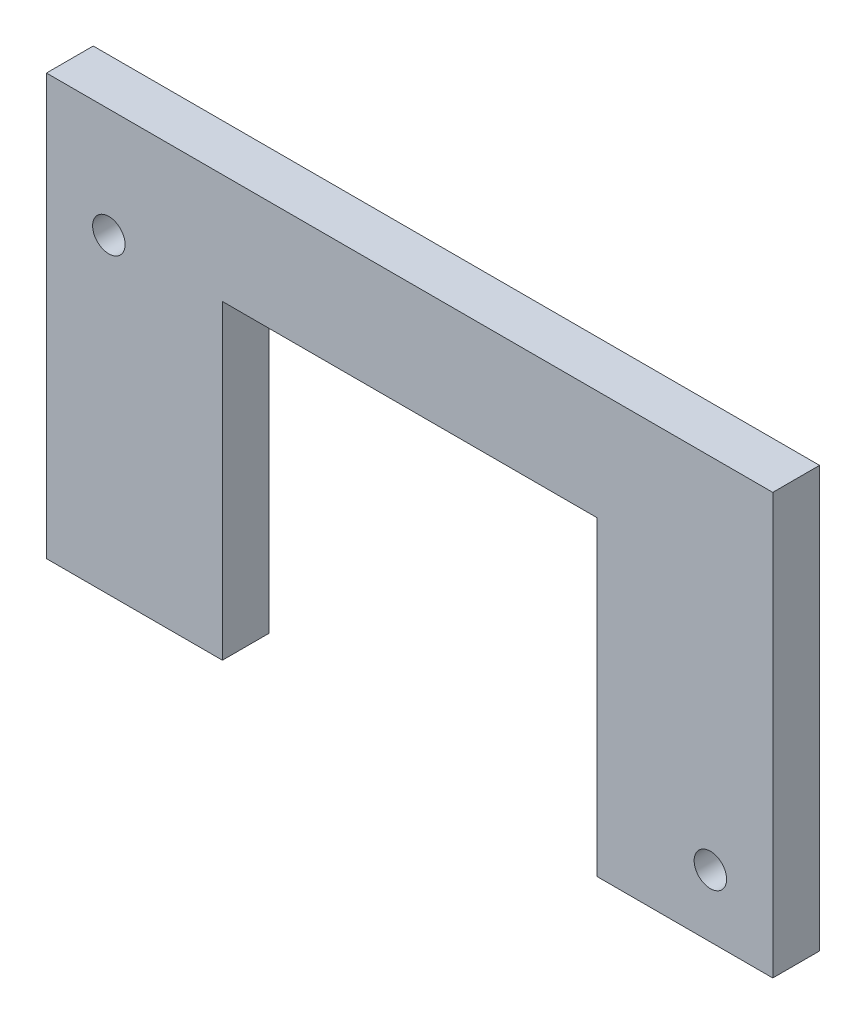
from build123d import *

# Parameters (mm, degrees)
SKETCH1_W           = 36.957
SKETCH1_H           = 21.3995
SKETCH1_R           = 0.8255
BOSS_EXTRUDE1_DEPTH = 2.38125
CUT_EXTRUDE1_REACH  = 42.61
SKETCH2_W           = 19.05
SKETCH2_H           = 15.8115


with BuildPart() as part:
    # Sketch1 → Boss-Extrude1 (new body)
    with BuildSketch(Plane.XY):
        with Locations((16.891, 9.11225)):
            Rectangle(SKETCH1_W, SKETCH1_H)
        with Locations((1.5875, 14.25575)):
            Circle(SKETCH1_R, mode=Mode.SUBTRACT)
        with Locations((32.1945, 1.5875)):
            Circle(SKETCH1_R, mode=Mode.SUBTRACT)
    extrude(amount=BOSS_EXTRUDE1_DEPTH)

    # Sketch2 → Cut-Extrude1 (cut, up to next)
    with BuildSketch(Plane.XY.offset(2.38125), mode=Mode.PRIVATE) as cut_extrude1_sk1:
        with Locations((16.891, 6.31825)):
            Rectangle(SKETCH2_W, SKETCH2_H)
    cut_extrude1_tool1 = extrude(cut_extrude1_sk1.sketch, amount=-CUT_EXTRUDE1_REACH, mode=Mode.PRIVATE) & part.part
    add(cut_extrude1_tool1.solids().sort_by_distance((16.891, 6.31825, 2.38125))[0], mode=Mode.SUBTRACT)


solid = part.part
